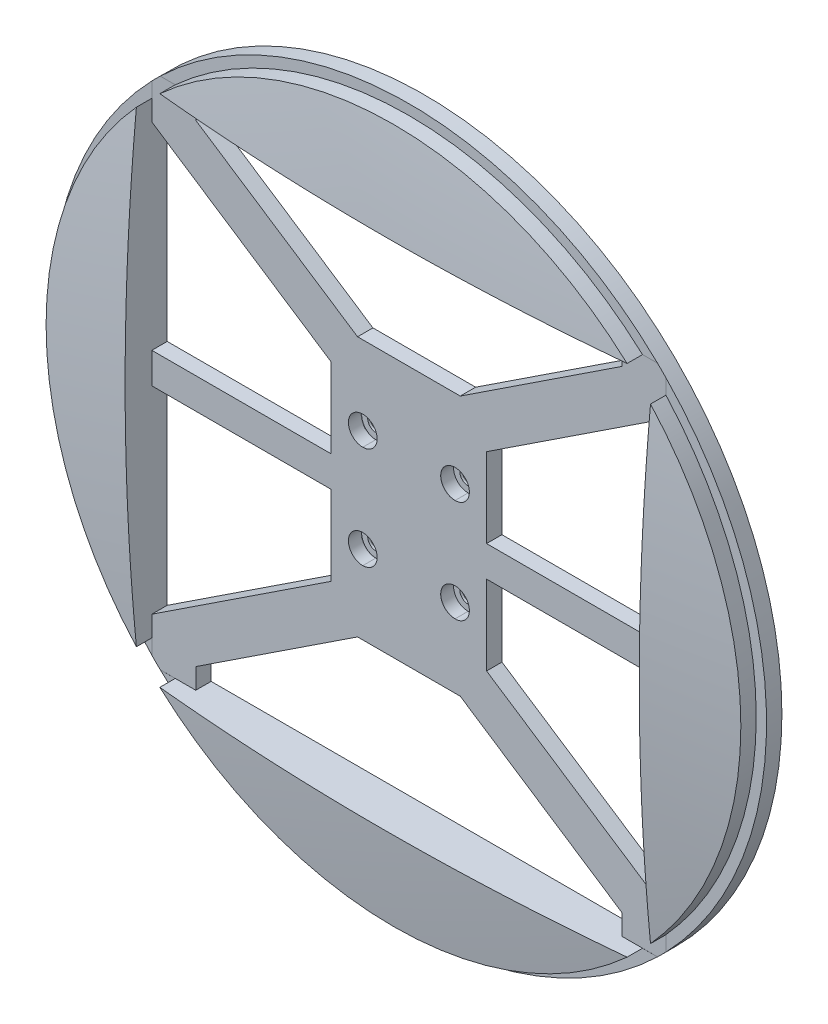
from build123d import *

# Parameters (mm, degrees)
BOSS_EXTRUDE1_DEPTH                        = 3
SKETCH1_3_W                                = 100
SKETCH1_3_H                                = 100
BOSS_EXTRUDE2_DEPTH                        = 6
CUT_EXTRUDE1_DEPTH                         = 29
CUT_EXTRUDE1_DEPTH_BACK                    = 3
SKETCH3_W                                  = 100.3
SKETCH3_H                                  = 100.3
CUT_EXTRUDE2_DEPTH                         = 31.5
SKETCH6_R                                  = 1.6
CUT_EXTRUDE3_DEPTH                         = 31.5
SKETCH7_R                                  = 2.8
CUT_EXTRUDE4_DEPTH                         = 2.5
MIRROR1_AT_THE_SECOND_PLANE_COPY_1_SKETC_R = 1.6
MIRROR1_AT_THE_SECOND_PLANE_COPY_1_DEPTH   = 31.5
MIRROR1_AT_THE_SECOND_PLANE_COPY_2_SKETC_R = 2.8
MIRROR1_AT_THE_SECOND_PLANE_COPY_2_DEPTH   = 2.5
MIRROR2_COPY_1_SKETCH_R                    = 1.6
MIRROR2_COPY_1_DEPTH                       = 31.5
MIRROR2_COPY_2_SKETCH_R                    = 2.8
MIRROR2_COPY_2_DEPTH                       = 2.5
MIRROR2_COPY_3_SKETCH_R                    = 1.6
MIRROR2_COPY_3_DEPTH                       = 31.5
MIRROR2_COPY_4_SKETCH_R                    = 2.8
MIRROR2_COPY_4_DEPTH                       = 2.5
MIRROR2_COPY_5_SKETCH_R                    = 1.6
MIRROR2_COPY_5_DEPTH                       = 31.5
MIRROR2_COPY_6_SKETCH_R                    = 2.8
MIRROR2_COPY_6_DEPTH                       = 2.5
MIRROR2_COPY_7_SKETCH_R                    = 1.6
MIRROR2_COPY_7_DEPTH                       = 31.5
MIRROR2_COPY_8_SKETCH_R                    = 2.8
MIRROR2_COPY_8_DEPTH                       = 2.5


with BuildPart() as part:
    # Sketch1 → Boss-Extrude1 (new body)
    with BuildSketch(Plane.XY):
        with BuildLine():
            add(Edge.make_bspline(
                [(-58.095859808, 92.414870473), (-54.99484825, 99.702137979), (-43.458782271, 107.390409353)],
                knots=[0.590507111, 0.590507111, 0.590507111, 1, 1, 1], degree=2))
            add(Edge.make_bspline(
                [(-58.095859808, 92.414870473), (-63.296986559, 98.387208449), (-76.644243794, 102.134348603)],
                knots=[0.590507111, 0.590507111, 0.590507111, 1, 1, 1], degree=2))
            add(Edge.make_bspline(
                [(-85.937235751, 83.368659058), (-85.239888004, 91.257527577), (-76.644243794, 102.134348603)],
                knots=[0.590507111, 0.590507111, 0.590507111, 1, 1, 1], degree=2))
            add(Edge.make_bspline(
                [(-85.937235751, 83.368659058), (-92.72935517, 87.441453453), (-106.581281126, 86.8806662)],
                knots=[0.590507111, 0.590507111, 0.590507111, 1, 1, 1], degree=2))
            add(Edge.make_bspline(
                [(-109.620524703, 66.161742432), (-111.395102022, 73.879994548), (-106.581281126, 86.8806662)],
                knots=[0.590507111, 0.590507111, 0.590507111, 1, 1, 1], degree=2))
            add(Edge.make_bspline(
                [(-109.620524703, 66.161742432), (-117.338776818, 67.936319752), (-130.33944847, 63.122498855)],
                knots=[0.590507111, 0.590507111, 0.590507111, 1, 1, 1], degree=2))
            add(Edge.make_bspline(
                [(-126.827441329, 42.47845348), (-130.900235723, 49.2705729), (-130.33944847, 63.122498855)],
                knots=[0.590507111, 0.590507111, 0.590507111, 1, 1, 1], degree=2))
            add(Edge.make_bspline(
                [(-126.827441329, 42.47845348), (-134.716309848, 41.781105734), (-145.593130873, 33.185461523)],
                knots=[0.590507111, 0.590507111, 0.590507111, 1, 1, 1], degree=2))
            add(Edge.make_bspline(
                [(-135.873652743, 14.637077537), (-141.84599072, 19.838204288), (-145.593130873, 33.185461523)],
                knots=[0.590507111, 0.590507111, 0.590507111, 1, 1, 1], degree=2))
            add(Edge.make_bspline(
                [(-135.873652743, 14.637077537), (-143.160920249, 11.53606598), (-150.849191624, 0)],
                knots=[0.590507111, 0.590507111, 0.590507111, 1, 1, 1], degree=2))
            add(Edge.make_bspline(
                [(-135.873652743, -14.637077537), (-143.160920249, -11.53606598), (-150.849191624, 0)],
                knots=[0.590507111, 0.590507111, 0.590507111, 1, 1, 1], degree=2))
            add(Edge.make_bspline(
                [(-135.873652743, -14.637077537), (-141.84599072, -19.838204288), (-145.593130873, -33.185461523)],
                knots=[0.590507111, 0.590507111, 0.590507111, 1, 1, 1], degree=2))
            add(Edge.make_bspline(
                [(-126.827441329, -42.478453481), (-134.716309848, -41.781105734), (-145.593130873, -33.185461523)],
                knots=[0.590507111, 0.590507111, 0.590507111, 1, 1, 1], degree=2))
            add(Edge.make_bspline(
                [(-126.827441329, -42.478453481), (-130.900235723, -49.2705729), (-130.33944847, -63.122498855)],
                knots=[0.590507111, 0.590507111, 0.590507111, 1, 1, 1], degree=2))
            add(Edge.make_bspline(
                [(-109.620524703, -66.161742432), (-117.338776818, -67.936319752), (-130.33944847, -63.122498855)],
                knots=[0.590507111, 0.590507111, 0.590507111, 1, 1, 1], degree=2))
            add(Edge.make_bspline(
                [(-109.620524703, -66.161742432), (-111.395102022, -73.879994548), (-106.581281126, -86.8806662)],
                knots=[0.590507111, 0.590507111, 0.590507111, 1, 1, 1], degree=2))
            add(Edge.make_bspline(
                [(-85.937235751, -83.368659058), (-92.72935517, -87.441453453), (-106.581281126, -86.8806662)],
                knots=[0.590507111, 0.590507111, 0.590507111, 1, 1, 1], degree=2))
            add(Edge.make_bspline(
                [(-85.937235751, -83.368659058), (-85.239888004, -91.257527577), (-76.644243794, -102.134348603)],
                knots=[0.590507111, 0.590507111, 0.590507111, 1, 1, 1], degree=2))
            add(Edge.make_bspline(
                [(-58.095859808, -92.414870473), (-63.296986559, -98.387208449), (-76.644243794, -102.134348603)],
                knots=[0.590507111, 0.590507111, 0.590507111, 1, 1, 1], degree=2))
            add(Edge.make_bspline(
                [(-58.095859808, -92.414870473), (-54.99484825, -99.702137979), (-43.458782271, -107.390409353)],
                knots=[0.590507111, 0.590507111, 0.590507111, 1, 1, 1], degree=2))
            add(Edge.make_bspline(
                [(-28.821704733, -92.414870473), (-31.922716291, -99.702137979), (-43.458782271, -107.390409353)],
                knots=[0.590507111, 0.590507111, 0.590507111, 1, 1, 1], degree=2))
            add(Edge.make_bspline(
                [(-28.821704733, -92.414870473), (-23.620577982, -98.387208449), (-10.273320747, -102.134348603)],
                knots=[0.590507111, 0.590507111, 0.590507111, 1, 1, 1], degree=2))
            add(Edge.make_bspline(
                [(-0.98032879, -83.368659058), (-1.677676537, -91.257527577), (-10.273320747, -102.134348603)],
                knots=[0.590507111, 0.590507111, 0.590507111, 1, 1, 1], degree=2))
            add(Edge.make_bspline(
                [(-0.98032879, -83.368659058), (5.811790629, -87.441453453), (19.663716585, -86.8806662)],
                knots=[0.590507111, 0.590507111, 0.590507111, 1, 1, 1], degree=2))
            add(Edge.make_bspline(
                [(22.702960162, -66.161742432), (24.477537481, -73.879994548), (19.663716585, -86.8806662)],
                knots=[0.590507111, 0.590507111, 0.590507111, 1, 1, 1], degree=2))
            add(Edge.make_bspline(
                [(22.702960162, -66.161742432), (30.421212277, -67.936319752), (43.421883929, -63.122498855)],
                knots=[0.590507111, 0.590507111, 0.590507111, 1, 1, 1], degree=2))
            add(Edge.make_bspline(
                [(39.909876788, -42.478453481), (43.982671182, -49.2705729), (43.421883929, -63.122498855)],
                knots=[0.590507111, 0.590507111, 0.590507111, 1, 1, 1], degree=2))
            add(Edge.make_bspline(
                [(39.909876788, -42.478453481), (47.798745307, -41.781105734), (58.675566332, -33.185461523)],
                knots=[0.590507111, 0.590507111, 0.590507111, 1, 1, 1], degree=2))
            add(Edge.make_bspline(
                [(48.956088202, -14.637077537), (54.928426179, -19.838204288), (58.675566332, -33.185461523)],
                knots=[0.590507111, 0.590507111, 0.590507111, 1, 1, 1], degree=2))
            add(Edge.make_bspline(
                [(48.956088202, -14.637077537), (56.243355708, -11.53606598), (63.931627083, 0)],
                knots=[0.590507111, 0.590507111, 0.590507111, 1, 1, 1], degree=2))
            add(Edge.make_bspline(
                [(48.956088202, 14.637077537), (56.243355708, 11.53606598), (63.931627083, 0)],
                knots=[0.590507111, 0.590507111, 0.590507111, 1, 1, 1], degree=2))
            add(Edge.make_bspline(
                [(48.956088202, 14.637077537), (54.928426179, 19.838204288), (58.675566332, 33.185461523)],
                knots=[0.590507111, 0.590507111, 0.590507111, 1, 1, 1], degree=2))
            add(Edge.make_bspline(
                [(39.909876788, 42.478453481), (47.798745307, 41.781105734), (58.675566332, 33.185461523)],
                knots=[0.590507111, 0.590507111, 0.590507111, 1, 1, 1], degree=2))
            add(Edge.make_bspline(
                [(39.909876788, 42.478453481), (43.982671182, 49.2705729), (43.421883929, 63.122498855)],
                knots=[0.590507111, 0.590507111, 0.590507111, 1, 1, 1], degree=2))
            add(Edge.make_bspline(
                [(22.702960162, 66.161742432), (30.421212277, 67.936319752), (43.421883929, 63.122498855)],
                knots=[0.590507111, 0.590507111, 0.590507111, 1, 1, 1], degree=2))
            add(Edge.make_bspline(
                [(22.702960162, 66.161742432), (24.477537482, 73.879994548), (19.663716585, 86.8806662)],
                knots=[0.590507111, 0.590507111, 0.590507111, 1, 1, 1], degree=2))
            add(Edge.make_bspline(
                [(-0.98032879, 83.368659058), (5.811790629, 87.441453453), (19.663716585, 86.8806662)],
                knots=[0.590507111, 0.590507111, 0.590507111, 1, 1, 1], degree=2))
            add(Edge.make_bspline(
                [(-0.98032879, 83.368659058), (-1.677676537, 91.257527577), (-10.273320747, 102.134348603)],
                knots=[0.590507111, 0.590507111, 0.590507111, 1, 1, 1], degree=2))
            add(Edge.make_bspline(
                [(-28.821704733, 92.414870473), (-23.620577982, 98.387208449), (-10.273320747, 102.134348603)],
                knots=[0.590507111, 0.590507111, 0.590507111, 1, 1, 1], degree=2))
            add(Edge.make_bspline(
                [(-28.821704733, 92.414870473), (-31.922716291, 99.702137979), (-43.458782271, 107.390409353)],
                knots=[0.590507111, 0.590507111, 0.590507111, 1, 1, 1], degree=2))
        make_face()
    extrude(amount=BOSS_EXTRUDE1_DEPTH)

    # Sketch1<3> → Boss-Extrude2 (add)
    with BuildSketch(Plane.XY):
        with BuildLine():
            Line((-37.418748753, 72.231622239), (-49.498815788, 72.231622239))
            add(Edge.make_bspline(
                [(-49.498815788, 72.231622239), (-53.492321192, 75.187958714), (-55.847955281, 78.22215986)],
                knots=[0, 0, 0, 0.180443943, 0.180443943, 0.180443943], degree=2))
            add(Edge.make_bspline(
                [(-55.847955281, 78.22215986), (-49.931141328, 94.634849858), (-76.644243794, 102.134348603)],
                knots=[0.180443943, 0.180443943, 0.180443943, 1, 1, 1], degree=2))
            add(Edge.make_bspline(
                [(-76.644243794, 102.134348603), (-93.847502899, 80.365558997), (-79.413562727, 70.565229847)],
                knots=[0.590507111, 0.590507111, 0.590507111, 1.410063168, 1.410063168, 1.410063168], degree=2))
            add(Edge.make_bspline(
                [(-81.028974809, 61.986852548), (-79.535852051, 66.725902578), (-79.413562727, 70.565229847)],
                knots=[0, 0, 0, 0.180443943, 0.180443943, 0.180443943], degree=2))
            Line((-81.028974809, 61.986852548), (-90.801954334, 54.886367297))
            add(Edge.make_bspline(
                [(-90.801954334, 54.886367297), (-95.770459054, 54.930770166), (-99.45966575, 56.00088348)],
                knots=[0, 0, 0, 0.180443943, 0.180443943, 0.180443943], degree=2))
            add(Edge.make_bspline(
                [(-99.45966575, 56.00088348), (-104.319999841, 72.756844594), (-130.33944847, 63.122498855)],
                knots=[0.180443943, 0.180443943, 0.180443943, 1, 1, 1], degree=2))
            add(Edge.make_bspline(
                [(-130.33944847, 63.122498855), (-131.461803954, 35.399356124), (-114.024012117, 35.954780456)],
                knots=[0.590507111, 0.590507111, 0.590507111, 1.410063168, 1.410063168, 1.410063168], degree=2))
            add(Edge.make_bspline(
                [(-110.28866428, 28.065212039), (-111.866246312, 32.776819588), (-114.024012117, 35.954780456)],
                knots=[0, 0, 0, 0.180443943, 0.180443943, 0.180443943], degree=2))
            Line((-110.28866428, 28.065212039), (-114.021610287, 16.576385567))
            add(Edge.make_bspline(
                [(-114.021610287, 16.576385567), (-118.067314393, 13.691894442), (-121.68094213, 12.38917301)],
                knots=[0, 0, 0, 0.180443943, 0.180443943, 0.180443943], degree=2))
            add(Edge.make_bspline(
                [(-121.68094213, 12.38917301), (-135.461941839, 23.088197609), (-150.849191624, 0)],
                knots=[0.180443943, 0.180443943, 0.180443943, 1, 1, 1], degree=2))
            add(Edge.make_bspline(
                [(-150.849191624, 0), (-135.461941839, -23.088197609), (-121.68094213, -12.38917301)],
                knots=[0.590507111, 0.590507111, 0.590507111, 1.410063168, 1.410063168, 1.410063168], degree=2))
            add(Edge.make_bspline(
                [(-114.021610287, -16.576385567), (-118.067314393, -13.691894442), (-121.68094213, -12.38917301)],
                knots=[0, 0, 0, 0.180443943, 0.180443943, 0.180443943], degree=2))
            Line((-114.021610287, -16.576385567), (-110.28866428, -28.065212039))
            add(Edge.make_bspline(
                [(-110.28866428, -28.065212039), (-111.866246312, -32.776819588), (-114.024012117, -35.954780456)],
                knots=[0, 0, 0, 0.180443943, 0.180443943, 0.180443943], degree=2))
            add(Edge.make_bspline(
                [(-114.024012117, -35.954780456), (-131.461803954, -35.399356124), (-130.33944847, -63.122498855)],
                knots=[0.180443943, 0.180443943, 0.180443943, 1, 1, 1], degree=2))
            add(Edge.make_bspline(
                [(-130.33944847, -63.122498855), (-104.319999841, -72.756844594), (-99.45966575, -56.00088348)],
                knots=[0.590507111, 0.590507111, 0.590507111, 1.410063168, 1.410063168, 1.410063168], degree=2))
            add(Edge.make_bspline(
                [(-90.801954334, -54.886367297), (-95.770459054, -54.930770166), (-99.45966575, -56.00088348)],
                knots=[0, 0, 0, 0.180443943, 0.180443943, 0.180443943], degree=2))
            Line((-90.801954334, -54.886367297), (-81.028974809, -61.986852548))
            add(Edge.make_bspline(
                [(-81.028974809, -61.986852548), (-79.535852051, -66.725902578), (-79.413562727, -70.565229847)],
                knots=[0, 0, 0, 0.180443943, 0.180443943, 0.180443943], degree=2))
            add(Edge.make_bspline(
                [(-79.413562727, -70.565229847), (-93.847502899, -80.365558997), (-76.644243794, -102.134348603)],
                knots=[0.180443943, 0.180443943, 0.180443943, 1, 1, 1], degree=2))
            add(Edge.make_bspline(
                [(-76.644243794, -102.134348603), (-49.931141328, -94.634849858), (-55.847955281, -78.22215986)],
                knots=[0.590507111, 0.590507111, 0.590507111, 1.410063168, 1.410063168, 1.410063168], degree=2))
            add(Edge.make_bspline(
                [(-49.498815788, -72.231622239), (-53.492321192, -75.187958714), (-55.847955281, -78.22215986)],
                knots=[0, 0, 0, 0.180443943, 0.180443943, 0.180443943], degree=2))
            Line((-49.498815788, -72.231622239), (-37.418748753, -72.231622239))
            add(Edge.make_bspline(
                [(-37.418748753, -72.231622239), (-33.425243349, -75.187958714), (-31.06960926, -78.22215986)],
                knots=[0, 0, 0, 0.180443943, 0.180443943, 0.180443943], degree=2))
            add(Edge.make_bspline(
                [(-31.06960926, -78.22215986), (-36.986423213, -94.634849858), (-10.273320747, -102.134348603)],
                knots=[0.180443943, 0.180443943, 0.180443943, 1, 1, 1], degree=2))
            add(Edge.make_bspline(
                [(-10.273320747, -102.134348603), (6.929938358, -80.365558997), (-7.504001814, -70.565229847)],
                knots=[0.590507111, 0.590507111, 0.590507111, 1.410063168, 1.410063168, 1.410063168], degree=2))
            add(Edge.make_bspline(
                [(-5.888589732, -61.986852548), (-7.38171249, -66.725902578), (-7.504001814, -70.565229847)],
                knots=[0, 0, 0, 0.180443943, 0.180443943, 0.180443943], degree=2))
            Line((-5.888589732, -61.986852548), (3.884389793, -54.886367297))
            add(Edge.make_bspline(
                [(3.884389793, -54.886367297), (8.852894513, -54.930770166), (12.542101209, -56.00088348)],
                knots=[0, 0, 0, 0.180443943, 0.180443943, 0.180443943], degree=2))
            add(Edge.make_bspline(
                [(12.542101209, -56.00088348), (17.4024353, -72.756844594), (43.421883929, -63.122498855)],
                knots=[0.180443943, 0.180443943, 0.180443943, 1, 1, 1], degree=2))
            add(Edge.make_bspline(
                [(43.421883929, -63.122498855), (44.544239413, -35.399356124), (27.106447576, -35.954780456)],
                knots=[0.590507111, 0.590507111, 0.590507111, 1.410063168, 1.410063168, 1.410063168], degree=2))
            add(Edge.make_bspline(
                [(23.371099739, -28.065212039), (24.948681771, -32.776819588), (27.106447576, -35.954780456)],
                knots=[0, 0, 0, 0.180443943, 0.180443943, 0.180443943], degree=2))
            Line((23.371099739, -28.065212039), (27.104045746, -16.576385567))
            add(Edge.make_bspline(
                [(27.104045746, -16.576385567), (31.149749852, -13.691894442), (34.763377589, -12.38917301)],
                knots=[0, 0, 0, 0.180443943, 0.180443943, 0.180443943], degree=2))
            add(Edge.make_bspline(
                [(34.763377589, -12.38917301), (48.544377298, -23.088197609), (63.931627083, 0)],
                knots=[0.180443943, 0.180443943, 0.180443943, 1, 1, 1], degree=2))
            add(Edge.make_bspline(
                [(63.931627083, 0), (48.544377298, 23.088197609), (34.763377589, 12.38917301)],
                knots=[0.590507111, 0.590507111, 0.590507111, 1.410063168, 1.410063168, 1.410063168], degree=2))
            add(Edge.make_bspline(
                [(27.104045746, 16.576385567), (31.149749852, 13.691894442), (34.763377589, 12.38917301)],
                knots=[0, 0, 0, 0.180443943, 0.180443943, 0.180443943], degree=2))
            Line((27.104045746, 16.576385567), (23.371099739, 28.065212039))
            add(Edge.make_bspline(
                [(23.371099739, 28.065212039), (24.948681771, 32.776819588), (27.106447576, 35.954780456)],
                knots=[0, 0, 0, 0.180443943, 0.180443943, 0.180443943], degree=2))
            add(Edge.make_bspline(
                [(27.106447576, 35.954780456), (44.544239413, 35.399356124), (43.421883929, 63.122498855)],
                knots=[0.180443943, 0.180443943, 0.180443943, 1, 1, 1], degree=2))
            add(Edge.make_bspline(
                [(43.421883929, 63.122498855), (17.4024353, 72.756844594), (12.542101209, 56.00088348)],
                knots=[0.590507111, 0.590507111, 0.590507111, 1.410063168, 1.410063168, 1.410063168], degree=2))
            add(Edge.make_bspline(
                [(3.884389793, 54.886367297), (8.852894513, 54.930770166), (12.542101209, 56.00088348)],
                knots=[0, 0, 0, 0.180443943, 0.180443943, 0.180443943], degree=2))
            Line((3.884389793, 54.886367297), (-5.888589732, 61.986852548))
            add(Edge.make_bspline(
                [(-5.888589732, 61.986852548), (-7.38171249, 66.725902578), (-7.504001814, 70.565229847)],
                knots=[0, 0, 0, 0.180443943, 0.180443943, 0.180443943], degree=2))
            add(Edge.make_bspline(
                [(-7.504001814, 70.565229847), (6.929938358, 80.365558997), (-10.273320747, 102.134348603)],
                knots=[0.180443943, 0.180443943, 0.180443943, 1, 1, 1], degree=2))
            add(Edge.make_bspline(
                [(-10.273320747, 102.134348603), (-36.986423213, 94.634849858), (-31.06960926, 78.22215986)],
                knots=[0.590507111, 0.590507111, 0.590507111, 1.410063168, 1.410063168, 1.410063168], degree=2))
            add(Edge.make_bspline(
                [(-37.418748753, 72.231622239), (-33.425243349, 75.187958714), (-31.06960926, 78.22215986)],
                knots=[0, 0, 0, 0.180443943, 0.180443943, 0.180443943], degree=2))
        make_face()
        with Locations((-43.458782271, 0)):
            Rectangle(SKETCH1_3_W, SKETCH1_3_H, mode=Mode.SUBTRACT)
    extrude(amount=BOSS_EXTRUDE2_DEPTH)

    # Sketch2 → Revolve1 (revolve)
    with BuildSketch(Plane(origin=(-43.458782271, 0, 0), x_dir=(0, 0, -1), z_dir=(1, 0, 0))):
        with BuildLine():
            Line((-3, 0), (-11, 0))
            add(Edge.make_bspline(
                [(-5.374929977, 72.089673671), (-10.84155735, 36.052053919), (-11, 0)],
                knots=[0, 0, 0, 0.499655199, 0.499655199, 0.499655199], degree=2))
            Line((-5.374929977, 72.089673671), (-3, 72.089673671))
            Line((-3, 72.089673671), (-3, 0))
        make_face()
    revolve(axis=Axis((-43.458782271, 0, 3), (0, 0, 1)))

    # Sketch3 → Cut-Extrude1 (cut, two sides: drawn at the far end of the back side and taken through both)
    with BuildSketch(Plane.XY.offset(6).offset(-CUT_EXTRUDE1_DEPTH_BACK)):
        with Locations((-43.458782271, 0)):
            Rectangle(SKETCH3_W, SKETCH3_H)
    extrude(amount=CUT_EXTRUDE1_DEPTH + CUT_EXTRUDE1_DEPTH_BACK, mode=Mode.SUBTRACT)

    # Sketch4 → Cut-Revolve1 (revolve, cut)
    with BuildSketch(Plane(origin=(-43.458782271, 0, 0), x_dir=(0, 0, -1), z_dir=(1, 0, 0))):
        Polygon((-6.011110651, 67.769965406), (-3.011110651, 67.769965406), (-3, 69.769934544), (3, 69.769934544), (3, 70.069934544), (-3.3, 70.069934544), (-3.3, 68.069934544), (-6.632007131, 68.069934544), (-6.632007131, 67.769965406), align=None)
    revolve(axis=Axis((-43.458782271, 0, 0), (0, 0, 1)), mode=Mode.SUBTRACT)


with BuildPart() as cut_revolve1_piece_1:
    # of the separate pieces the step leaves, piece 1, a body of its own (cut_revolve1_pieces)
    add(part.part.solids().sort_by_distance((-85.937235751, -83.368659058, 0))[0])


with BuildPart() as cut_revolve1_piece_2:
    # of the separate pieces the step leaves, piece 2, a body of its own (cut_revolve1_pieces)
    add(part.part.solids().sort_by_distance((-43.458782271, 69.769934544, 0))[0])

    # Sketch5 → Cut-Extrude2 (cut)
    with BuildSketch(Plane.XY.offset(3)):
        Polygon((-93.608782271, 41.582296028), (-58.608782271, 18.52638602), (-58.608782271, 3), (-93.608782271, 3), align=None)
        Polygon((-93.608782271, -41.582296028), (-58.608782271, -18.52638602), (-58.608782271, -3), (-93.608782271, -3), align=None)
        Polygon((6.691217729, 41.582296028), (-28.308782271, 18.52638602), (-28.308782271, 3), (6.691217729, 3), align=None)
        Polygon((6.691217729, -41.582296028), (6.691217729, -3), (-28.308782271, -3), (-28.308782271, -18.52638602), align=None)
        Polygon((-85.041078298, 50.15), (-1.876486243, 50.15), (-1.876486243, 46.15), (-33.441852936, 25.35662132), (-53.475711605, 25.35662132), (-85.041078298, 46.15), align=None)
        Polygon((-85.041078298, -46.15), (-53.475711605, -25.35662132), (-33.441852936, -25.35662132), (-1.876486243, -46.15), (-1.876486243, -50.15), (-85.041078298, -50.15), align=None)
    extrude(amount=-CUT_EXTRUDE2_DEPTH, mode=Mode.SUBTRACT)

    # Sketch6 → Cut-Extrude3 (cut)
    with BuildSketch(Plane.XY.offset(3)):
        with Locations((-52.458782271, -10)):
            Circle(SKETCH6_R)
    cut_extrude3 = extrude(amount=-CUT_EXTRUDE3_DEPTH, mode=Mode.SUBTRACT)

    # Sketch7 → Cut-Extrude4 (cut)
    with BuildSketch(Plane.XY.offset(3)):
        with Locations((-52.458782271, -10)):
            Circle(SKETCH7_R)
    cut_extrude4 = extrude(amount=-CUT_EXTRUDE4_DEPTH, mode=Mode.SUBTRACT)

    # Mirror1: Cut-Extrude3, Cut-Extrude4 across plane
    add(cut_extrude3.mirror(Plane(origin=(-43.467186028, 0, 0.127151753), x_dir=(0.0029252229321811967, 0, 0.9999957215262458), z_dir=(0.9999957215262458, 0, -0.0029252229321811967))), mode=Mode.SUBTRACT)
    add(cut_extrude4.mirror(Plane(origin=(-43.467186028, 0, 0.127151753), x_dir=(0.0029252229321811967, 0, 0.9999957215262458), z_dir=(0.9999957215262458, 0, -0.0029252229321811967))), mode=Mode.SUBTRACT)

    # Mirror1 at the second plane: Cut-Extrude3, Cut-Extrude4 across plane
    add(cut_extrude3.mirror(Plane.ZX), mode=Mode.SUBTRACT)
    add(cut_extrude4.mirror(Plane.ZX), mode=Mode.SUBTRACT)

    # Mirror1 at the second plane copy 1 sketc → Mirror1 at the second plane copy 1 (cut)
    with BuildSketch(Plane(origin=(-86.916820794, 0, 3.254252165), x_dir=(-0.999982886141594, -2.4905302147623156e-15, 0.005850420833383312), z_dir=(0.005850420833383312, -8.513947883066465e-13, 0.999982886141594))):
        with Locations((-52.458782271, -10)):
            Circle(MIRROR1_AT_THE_SECOND_PLANE_COPY_1_SKETC_R)
    extrude(amount=-MIRROR1_AT_THE_SECOND_PLANE_COPY_1_DEPTH, mode=Mode.SUBTRACT)

    # Mirror1 at the second plane copy 2 sketc → Mirror1 at the second plane copy 2 (cut)
    with BuildSketch(Plane(origin=(-86.916820794, 0, 3.254252165), x_dir=(-0.999982886141594, -2.4905302147623156e-15, 0.005850420833383312), z_dir=(0.005850420833383312, -8.513947883066465e-13, 0.999982886141594))):
        with Locations((-52.458782271, -10)):
            Circle(MIRROR1_AT_THE_SECOND_PLANE_COPY_2_SKETC_R)
    extrude(amount=-MIRROR1_AT_THE_SECOND_PLANE_COPY_2_DEPTH, mode=Mode.SUBTRACT)

    # Mirror2 copy 1 sketch → Mirror2 copy 1 (cut)
    with BuildSketch(Plane(origin=(-0.000743747, 0, 3.254252165), x_dir=(0.999982886141594, 0, 0.005850420833387938), z_dir=(-0.005850420833387938, 0, 0.999982886141594))):
        with Locations((-52.458782271, -10)):
            Circle(MIRROR2_COPY_1_SKETCH_R)
    extrude(amount=-MIRROR2_COPY_1_DEPTH, mode=Mode.SUBTRACT)

    # Mirror2 copy 2 sketch → Mirror2 copy 2 (cut)
    with BuildSketch(Plane(origin=(-0.000743747, 0, 3.254252165), x_dir=(0.999982886141594, 0, 0.005850420833387938), z_dir=(-0.005850420833387938, 0, 0.999982886141594))):
        with Locations((-52.458782271, -10)):
            Circle(MIRROR2_COPY_2_SKETCH_R)
    extrude(amount=-MIRROR2_COPY_2_DEPTH, mode=Mode.SUBTRACT)

    # Mirror2 copy 3 sketch → Mirror2 copy 3 (cut)
    with BuildSketch(Plane(origin=(-86.917564541, 0, 3), x_dir=(-1, 0, 0), z_dir=(0, 0, 1))):
        with Locations((-52.458782271, -10)):
            Circle(MIRROR2_COPY_3_SKETCH_R)
    extrude(amount=-MIRROR2_COPY_3_DEPTH, mode=Mode.SUBTRACT)

    # Mirror2 copy 4 sketch → Mirror2 copy 4 (cut)
    with BuildSketch(Plane(origin=(-86.917564541, 0, 3), x_dir=(-1, 0, 0), z_dir=(0, 0, 1))):
        with Locations((-52.458782271, -10)):
            Circle(MIRROR2_COPY_4_SKETCH_R)
    extrude(amount=-MIRROR2_COPY_4_DEPTH, mode=Mode.SUBTRACT)

    # Mirror2 copy 5 sketch → Mirror2 copy 5 (cut)
    with BuildSketch(Plane(origin=(-0.000743747, 0, 3.254252165), x_dir=(0.999982886141594, -2.4905302147623156e-15, 0.005850420833387938), z_dir=(-0.005850420833387938, -8.513947883066465e-13, 0.999982886141594))):
        with Locations((-52.458782271, 10)):
            Circle(MIRROR2_COPY_5_SKETCH_R)
    extrude(amount=-MIRROR2_COPY_5_DEPTH, mode=Mode.SUBTRACT)

    # Mirror2 copy 6 sketch → Mirror2 copy 6 (cut)
    with BuildSketch(Plane(origin=(-0.000743747, 0, 3.254252165), x_dir=(0.999982886141594, -2.4905302147623156e-15, 0.005850420833387938), z_dir=(-0.005850420833387938, -8.513947883066465e-13, 0.999982886141594))):
        with Locations((-52.458782271, 10)):
            Circle(MIRROR2_COPY_6_SKETCH_R)
    extrude(amount=-MIRROR2_COPY_6_DEPTH, mode=Mode.SUBTRACT)

    # Mirror2 copy 7 sketch → Mirror2 copy 7 (cut)
    with BuildSketch(Plane(origin=(-86.917564541, 0, 3), x_dir=(-1, 0, 0), z_dir=(0, 0, 1))):
        with Locations((-52.458782271, 10)):
            Circle(MIRROR2_COPY_7_SKETCH_R)
    extrude(amount=-MIRROR2_COPY_7_DEPTH, mode=Mode.SUBTRACT)

    # Mirror2 copy 8 sketch → Mirror2 copy 8 (cut)
    with BuildSketch(Plane(origin=(-86.917564541, 0, 3), x_dir=(-1, 0, 0), z_dir=(0, 0, 1))):
        with Locations((-52.458782271, 10)):
            Circle(MIRROR2_COPY_8_SKETCH_R)
    extrude(amount=-MIRROR2_COPY_8_DEPTH, mode=Mode.SUBTRACT)


solid = cut_revolve1_piece_2.part
